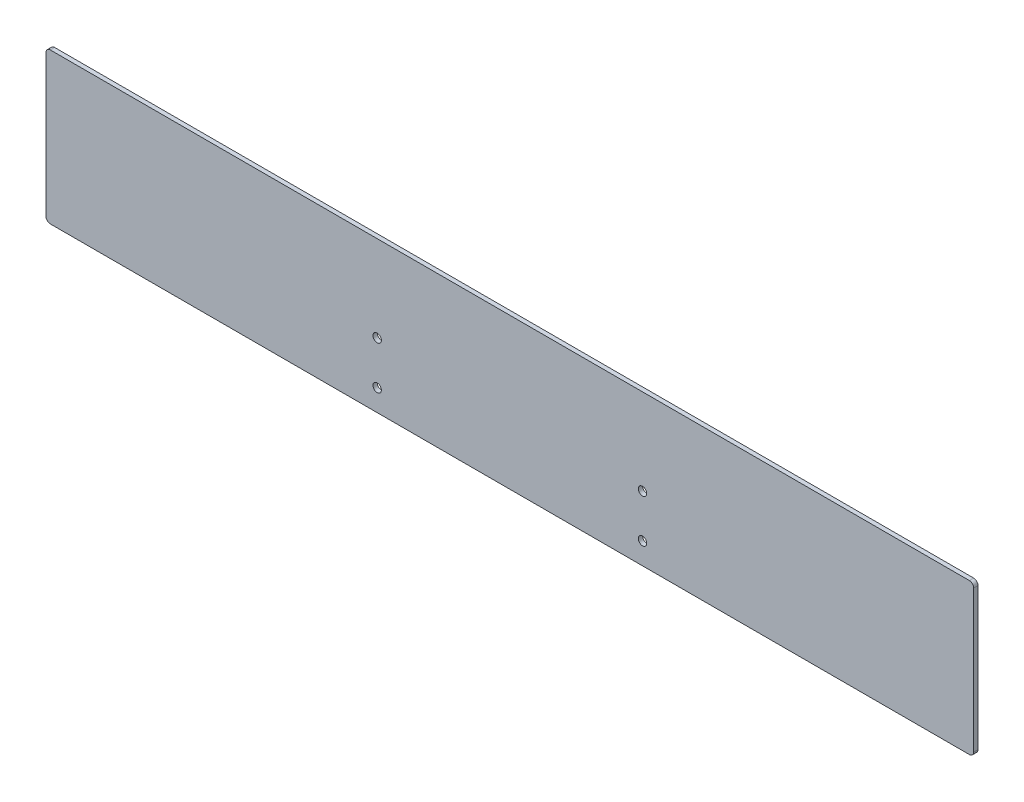
from build123d import *

# Parameters (mm, degrees)
SKETCH1_W           = 430
SKETCH1_H           = 69.85
SKETCH1_R           = 1.95
BOSS_EXTRUDE1_DEPTH = 2
FILLET1_R           = 2


with BuildPart() as part:
    # Sketch1 → Boss-Extrude1 (new body)
    with BuildSketch(Plane.XY):
        with Locations((-141.905896291, -9.371482412)):
            Rectangle(SKETCH1_W, SKETCH1_H)
        with Locations((-80.405896291, -14.296482412)):
            Circle(SKETCH1_R, mode=Mode.SUBTRACT)
        with Locations((-80.405896291, -34.296482412)):
            Circle(SKETCH1_R, mode=Mode.SUBTRACT)
        with Locations((-203.405896291, -14.296482412)):
            Circle(SKETCH1_R, mode=Mode.SUBTRACT)
        with Locations((-203.405896291, -34.296482412)):
            Circle(SKETCH1_R, mode=Mode.SUBTRACT)
    extrude(amount=BOSS_EXTRUDE1_DEPTH)

    # Fillet1
    fillet1_edges = [part.edges().sort_by_distance(p)[0] for p in [
        (73.094103709, 25.553517588, 1),
        (73.094103709, -44.296482412, 1),
        (-356.905896291, -44.296482412, 1),
        (-356.905896291, 25.553517588, 1),
    ]]
    fillet(fillet1_edges, radius=FILLET1_R)


solid = part.part
